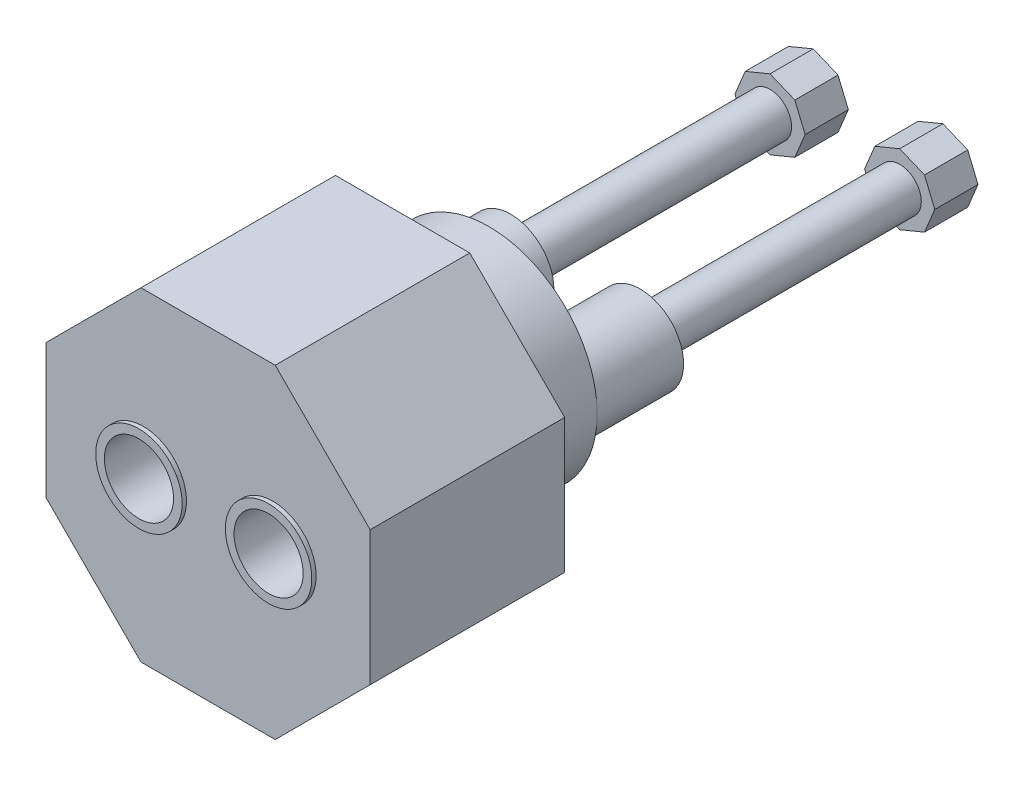
from build123d import *

# Parameters (mm, degrees)
BOSS_EXTRUDE1_DEPTH = 45
BOSS_EXTRUDE2_START = -40
SKETCH1_3_R         = 10
BOSS_EXTRUDE2_DEPTH = 86
SKETCH1_4_R         = 10
BOSS_EXTRUDE3_DEPTH = 40
SKETCH1_5_R         = 25
BOSS_EXTRUDE4_DEPTH = 20
SKETCH2_R           = 5
BOSS_EXTRUDE5_DEPTH = 60
BOSS_EXTRUDE6_DEPTH = 10
SKETCH4_R           = 8
CUT_EXTRUDE2_DEPTH  = 15


with BuildPart() as part:
    # Sketch1 → Boss-Extrude1 (new body)
    with BuildSketch(Plane.XY):
        Polygon((15.533008589, 37.5), (-15.533008589, 37.5), (-37.5, 15.533008589), (-37.5, -15.533008589), (-15.533008589, -37.5), (15.533008589, -37.5), (37.5, -15.533008589), (37.5, 15.533008589), align=None)
    extrude(amount=BOSS_EXTRUDE1_DEPTH)

    # Sketch1<3> → Boss-Extrude2 (add)
    with BuildSketch(Plane.XY.offset(BOSS_EXTRUDE2_START)):
        with Locations((-15, 0)):
            Circle(SKETCH1_3_R)
    boss_extrude2 = extrude(amount=BOSS_EXTRUDE2_DEPTH)

    # Sketch1<4> → Boss-Extrude3 (add)
    with BuildSketch(Plane.XY):
        with Locations((15, 0)):
            Circle(SKETCH1_4_R)
    extrude(amount=-BOSS_EXTRUDE3_DEPTH)

    # Sketch1<5> → Boss-Extrude4 (add)
    with BuildSketch(Plane.XY):
        Circle(SKETCH1_5_R)
    extrude(amount=-BOSS_EXTRUDE4_DEPTH)

    # Sketch2 → Boss-Extrude5 (add)
    with BuildSketch(Plane(origin=(0, 0, -40), x_dir=(-1, 0, 0), z_dir=(0, 0, -1))):
        with Locations((15, 0)):
            Circle(SKETCH2_R)
    boss_extrude5 = extrude(amount=BOSS_EXTRUDE5_DEPTH)

    # Mirror2: Boss-Extrude5 across plane
    add(boss_extrude5.mirror(Plane(origin=(0, 0, 0), x_dir=(0, 0, 1), z_dir=(1, 0, 0))))

    # Sketch3 → Boss-Extrude6 (add)
    with BuildSketch(Plane(origin=(0, 0, -100), x_dir=(-1, 0, 0), z_dir=(0, 0, -1))):
        Polygon((-6.882058498, 0), (-9.259748515, 5.740251485), (-15, 8.117941502), (-20.740251485, 5.740251485), (-23.117941502, 0), (-20.740251485, -5.740251485), (-15, -8.117941502), (-9.259748515, -5.740251485), align=None)
    boss_extrude6 = extrude(amount=BOSS_EXTRUDE6_DEPTH)

    # Mirror3: Boss-Extrude6 across plane
    add(boss_extrude6.mirror(Plane(origin=(0, 0, 0), x_dir=(0, 0, 1), z_dir=(1, 0, 0))))

    # Mirror4: Boss-Extrude2 across plane
    add(boss_extrude2.mirror(Plane(origin=(0, 0, 0), x_dir=(0, 0, 1), z_dir=(1, 0, 0))))

    # Sketch4 → Cut-Extrude2 (cut)
    with BuildSketch(Plane.XY.offset(46)):
        with Locations((-15, 0)):
            Circle(SKETCH4_R)
    cut_extrude2 = extrude(amount=-CUT_EXTRUDE2_DEPTH, mode=Mode.SUBTRACT)

    # Mirror5: Cut-Extrude2 across plane
    add(cut_extrude2.mirror(Plane(origin=(0, 0, 0), x_dir=(0, 0, 1), z_dir=(1, 0, 0))), mode=Mode.SUBTRACT)


solid = part.part
